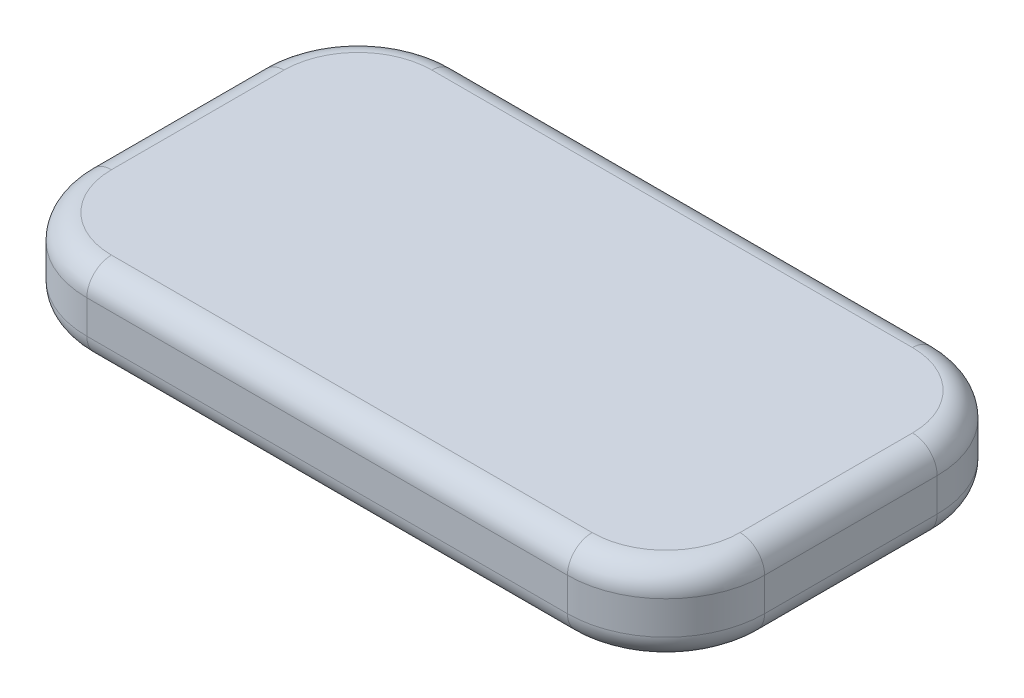
from build123d import *

# Parameters (mm, degrees)
SKETCH2_W           = 139.7
SKETCH2_H           = 76.2
BOSS_EXTRUDE1_DEPTH = 17.018
FILLET1_R           = 20.32
FILLET2_R           = 5.08
FILLET3_R           = 5.08


with BuildPart() as part:
    # Sketch2 → Boss-Extrude1 (new body)
    with BuildSketch(Plane(origin=(0, 0, 0), x_dir=(1, 0, 0), z_dir=(0, 1, 0))):
        with Locations((69.85, 38.1)):
            Rectangle(SKETCH2_W, SKETCH2_H)
    extrude(amount=BOSS_EXTRUDE1_DEPTH)

    # Fillet1
    fillet1_edges = [part.edges().sort_by_distance(p)[0] for p in [
        (139.7, 8.509, 0),
        (139.7, 8.509, -76.2),
        (0, 8.509, -76.2),
        (0, 8.509, 0),
    ]]
    fillet(fillet1_edges, radius=FILLET1_R)

    # Fillet2
    fillet2_edges = [part.edges().sort_by_distance(p)[0] for p in [
        (5.951590206, 17.018, -5.951590206),
        (69.85, 17.018, 0),
        (133.748409794, 17.018, -5.951590206),
        (139.7, 17.018, -38.1),
        (133.748409794, 17.018, -70.248409794),
        (69.85, 17.018, -76.2),
        (5.951590206, 17.018, -70.248409794),
        (0, 17.018, -38.1),
    ]]
    fillet(fillet2_edges, radius=FILLET2_R)

    # Fillet3
    fillet3_edges = [part.edges().sort_by_distance(p)[0] for p in [
        (5.951590206, 0, -5.951590206),
        (69.85, 0, 0),
        (133.748409794, 0, -5.951590206),
        (139.7, 0, -38.1),
        (133.748409794, 0, -70.248409794),
        (69.85, 0, -76.2),
        (5.951590206, 0, -70.248409794),
        (0, 0, -38.1),
    ]]
    fillet(fillet3_edges, radius=FILLET3_R)


solid = part.part
